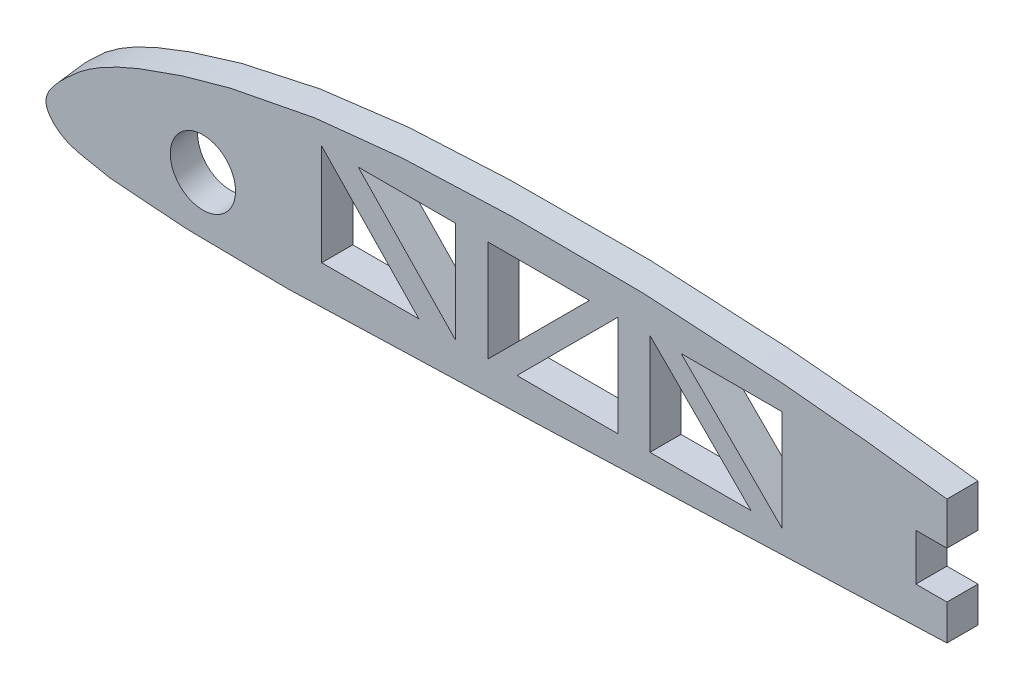
from build123d import *

# Parameters (mm, degrees)
SKETCH_4_W          = 2
SKETCH_4_H          = 3
CUT_EXTRUDE_1_DEPTH = 10
CUT_EXTRUDE_2_DEPTH = 10
SKETCH_7_R          = 2.1


with BuildPart() as part:
    # 边界1: read off the stored shape, not the designer's step
    # 边界1: loft between two sections, ruled curve by curve
    other_1_from = [
        Edge.make_bspline([(114.495486172, -0.065052731, 2), (112.525313713, -0.137418444, 2), (108.584936836, -0.282111358, 2), (102.674405126, -0.499184959, 2), (96.763856033, -0.716241585, 2), (91.838407723, -0.897137932, 2), (87.898044291, -1.041841681, 2), (84.942774489, -1.150391705, 2), (81.987503864, -1.258953778, 2), (79.032232565, -1.367478794, 2), (76.076958398, -1.475934997, 2), (73.12168408, -1.584382248, 2), (70.166411608, -1.692882482, 2), (67.211149141, -1.801653391, 2), (64.255892421, -1.910581232, 2), (61.300625434, -2.019229556, 2), (58.34532908, -2.127078553, 2), (55.390002445, -2.234089948, 2), (52.434708583, -2.342012705, 2), (49.479510926, -2.452535052, 2), (47.016955341, -2.54753161, 2), (45.046742895, -2.61905413, 2), (43.568961311, -2.669232614, 2), (42.091016655, -2.714387138, 2), (40.612889377, -2.75319201, 2), (39.134576881, -2.78416397, 2), (37.656086873, -2.805479396, 2), (36.177474753, -2.814931034, 2), (34.698825311, -2.810979174, 2), (33.220314429, -2.790618553, 2), (31.742108954, -2.753888604, 2), (30.264623613, -2.694123219, 2), (28.787927275, -2.619650713, 2), (27.558191615, -2.538256192, 2), (26.578186263, -2.430380652, 2), (25.846197236, -2.325486947, 2), (25.119410219, -2.189587549, 2), (24.393906066, -2.047208187, 2), (23.673072927, -1.88141167, 2), (23.098969383, -1.646698725, 2), (22.687774255, -1.372750645, 2), (22.405762629, -1.13272555, 2), (22.160415027, -0.854688888, 2), (21.968873367, -0.536042331, 2), (21.877041524, -0.171236682, 2), (21.932491412, 0.200662906, 2), (22.086819787, 0.53837321, 2), (22.291289979, 0.847230631, 2), (22.526145537, 1.133081398, 2), (22.777985786, 1.403785888, 2), (23.038654306, 1.665931032, 2), (23.302532619, 1.924798902, 2), (23.572222182, 2.177686933, 2), (23.94300328, 2.50252791, 2), (24.429622918, 2.881176313, 2), (25.045401109, 3.29111665, 2), (25.685591405, 3.661473232, 2), (26.342208206, 4.001575669, 2), (27.012317437, 4.31424432, 2), (27.692408294, 4.604359062, 2), (28.380035544, 4.876116393, 2), (29.073641491, 5.13213624, 2), (29.771562102, 5.376132386, 2), (30.473324083, 5.608835284, 2), (31.414127441, 5.903257348, 2), (32.599242862, 6.241189551, 2), (34.032937147, 6.603560906, 2), (35.475682008, 6.927865338, 2), (36.925796313, 7.217413086, 2), (38.38243318, 7.472115541, 2), (39.844922498, 7.690837739, 2), (41.801789711, 7.932030291, 2), (44.257157627, 8.148841893, 2), (47.210373206, 8.30816349, 2), (50.166102221, 8.406084649, 2), (53.122769422, 8.468100744, 2), (56.080133917, 8.481383364, 2), (59.037246841, 8.439956258, 2), (61.992862746, 8.336456991, 2), (64.946022813, 8.178834662, 2), (67.896174091, 7.972505736, 2), (70.843049381, 7.724040716, 2), (73.786093207, 7.433576909, 2), (76.724757768, 7.10180194, 2), (79.658466436, 6.728700193, 2), (82.587158849, 6.318307304, 2), (86.485672655, 5.72705015, 2), (91.347726065, 4.917789912, 2), (97.164206175, 3.843747138, 2), (102.960665954, 2.66719024, 2), (108.739776346, 1.407708383, 2), (112.577151384, 0.500675708, 2), (114.529394671, 0.037886323, 2), (114.596821986, 0.021902329, 2), (114.698157799, -0.002119851, 2), (114.799493613, -0.026142031, 2), (114.867050822, -0.042156817, 2), (114.900829426, -0.05016421, 2)], [0, 0, 0, 0, 0.031181105, 0.062362211, 0.093543316, 0.124724421, 0.140314974, 0.155905527, 0.171496079, 0.187086632, 0.202677185, 0.218267737, 0.23385829, 0.249448843, 0.265039395, 0.280629948, 0.296220501, 0.311811053, 0.327401606, 0.342992159, 0.358582711, 0.366377988, 0.374173264, 0.38196854, 0.389763817, 0.397559093, 0.405354369, 0.413149646, 0.420944922, 0.428740198, 0.436535474, 0.444330751, 0.452126027, 0.459921303, 0.463818942, 0.46771658, 0.471614218, 0.475511856, 0.479409494, 0.483307132, 0.485255952, 0.487204771, 0.48915359, 0.491102409, 0.493051228, 0.495000047, 0.496948866, 0.498897685, 0.500846504, 0.502795323, 0.504744142, 0.506692961, 0.508641781, 0.5105906, 0.514488238, 0.518385876, 0.522283514, 0.526181152, 0.53007879, 0.533976429, 0.537874067, 0.541771705, 0.545669343, 0.549566981, 0.553464619, 0.561259896, 0.569055172, 0.576850448, 0.584645725, 0.592441001, 0.600236277, 0.608031554, 0.623622106, 0.639212659, 0.654803212, 0.670393764, 0.685984317, 0.70157487, 0.717165422, 0.732755975, 0.748346528, 0.76393708, 0.779527633, 0.795118186, 0.810708738, 0.826299291, 0.841889844, 0.873070949, 0.904252054, 0.93543316, 0.966614265, 0.99779537, 0.99779537, 0.998346528, 0.998897685, 0.999448843, 1, 1, 1, 1], 3),
        Edge.make_line((114.900829426, -0.05016421, 2), (114.495486172, -0.065052731, 2)),
    ]
    other_1_to = [
        Edge.make_bspline([(114.494436874, -0.065091272, 0), (112.519164295, -0.137644316, 0), (108.568587489, -0.282712562, 0), (102.642754133, -0.50034686, 0), (96.716906123, -0.71796651, 0), (91.778706458, -0.899329433, 0), (87.828143038, -1.044409526, 0), (84.86522286, -1.153238964, 0), (81.902302125, -1.262083692, 0), (78.939380469, -1.370887028, 0), (75.976456211, -1.47962753, 0), (73.013531496, -1.588351231, 0), (70.050609157, -1.69714222, 0), (67.087696383, -1.806191874, 0), (64.124789301, -1.915397023, 0), (61.161872293, -2.024331861, 0), (58.19892541, -2.13245354, 0), (55.235948399, -2.239741975, 0), (52.273004055, -2.347939128, 0), (49.310156786, -2.458758462, 0), (46.841226159, -2.553993398, 0), (44.865913717, -2.625707031, 0), (43.384306508, -2.676011557, 0), (41.902535976, -2.721284207, 0), (40.420582303, -2.760189141, 0), (38.938442945, -2.791241446, 0), (37.456125609, -2.812611964, 0), (35.973685849, -2.822088107, 0), (34.491208669, -2.818125989, 0), (33.008870408, -2.797712668, 0), (31.526838344, -2.760887625, 0), (30.04552828, -2.700967523, 0), (28.56500926, -2.626302228, 0), (27.332090218, -2.544696989, 0), (26.349547957, -2.436542173, 0), (25.615664052, -2.331376914, 0), (24.886995626, -2.195125699, 0), (24.159613381, -2.052377767, 0), (23.436914251, -1.886152009, 0), (22.861324577, -1.650831376, 0), (22.449065053, -1.376174054, 0), (22.166323431, -1.135527566, 0), (21.920340771, -0.856771098, 0), (21.728303371, -0.537299607, 0), (21.636234005, -0.171549539, 0), (21.691827635, 0.201312739, 0), (21.846555611, 0.539897214, 0), (22.05155517, 0.849554126, 0), (22.287018723, 1.13614484, 0), (22.539510924, 1.407550076, 0), (22.800854235, 1.670373822, 0), (23.06541565, 1.929911809, 0), (23.335803361, 2.183454473, 0), (23.707544308, 2.509136334, 0), (24.195423667, 2.888764906, 0), (24.812795928, 3.299766409, 0), (25.454643482, 3.671081698, 0), (26.112960059, 4.012064526, 0), (26.784803992, 4.325542553, 0), (27.466655388, 4.616408291, 0), (28.156062684, 4.888869099, 0), (28.851464154, 5.145551684, 0), (29.551191455, 5.390179452, 0), (30.254770071, 5.623484724, 0), (31.198008864, 5.918668951, 0), (32.386192165, 6.257475904, 0), (33.823597816, 6.620785355, 0), (35.270077476, 6.945929198, 0), (36.723945649, 7.236226641, 0), (38.184353284, 7.491588117, 0), (39.65062849, 7.710877041, 0), (41.612561431, 7.952692849, 0), (44.074285409, 8.170067958, 0), (47.035146038, 8.329797938, 0), (49.998526223, 8.427979423, 0), (52.962847706, 8.490143425, 0), (55.927867077, 8.503483651, 0), (58.892635086, 8.4619306, 0), (61.855901957, 8.358166543, 0), (64.816706792, 8.200137578, 0), (67.774494984, 7.993272942, 0), (70.728998926, 7.744166511, 0), (73.679661001, 7.452948193, 0), (76.625933381, 7.120318459, 0), (79.567235887, 6.746247786, 0), (82.503510635, 6.334796721, 0), (86.41211395, 5.742010096, 0), (91.286755443, 4.930647196, 0), (97.118291571, 3.853828829, 0), (102.92975696, 2.674223702, 0), (108.72382731, 1.411482804, 0), (112.571136157, 0.502101649, 0), (114.52843315, 0.038114256, 0), (114.596035012, 0.022088885, 0), (114.69763315, -0.00199548, 0), (114.799231288, -0.026079845, 0), (114.86696338, -0.042136089, 0), (114.900829426, -0.05016421, 0)], [0, 0, 0, 0, 0.031181105, 0.062362211, 0.093543316, 0.124724421, 0.140314974, 0.155905527, 0.171496079, 0.187086632, 0.202677185, 0.218267737, 0.23385829, 0.249448843, 0.265039395, 0.280629948, 0.296220501, 0.311811053, 0.327401606, 0.342992159, 0.358582711, 0.366377988, 0.374173264, 0.38196854, 0.389763817, 0.397559093, 0.405354369, 0.413149646, 0.420944922, 0.428740198, 0.436535474, 0.444330751, 0.452126027, 0.459921303, 0.463818942, 0.46771658, 0.471614218, 0.475511856, 0.479409494, 0.483307132, 0.485255952, 0.487204771, 0.48915359, 0.491102409, 0.493051228, 0.495000047, 0.496948866, 0.498897685, 0.500846504, 0.502795323, 0.504744142, 0.506692961, 0.508641781, 0.5105906, 0.514488238, 0.518385876, 0.522283514, 0.526181152, 0.53007879, 0.533976429, 0.537874067, 0.541771705, 0.545669343, 0.549566981, 0.553464619, 0.561259896, 0.569055172, 0.576850448, 0.584645725, 0.592441001, 0.600236277, 0.608031554, 0.623622106, 0.639212659, 0.654803212, 0.670393764, 0.685984317, 0.70157487, 0.717165422, 0.732755975, 0.748346528, 0.76393708, 0.779527633, 0.795118186, 0.810708738, 0.826299291, 0.841889844, 0.873070949, 0.904252054, 0.93543316, 0.966614265, 0.99779537, 0.99779537, 0.998346528, 0.998897685, 0.999448843, 1, 1, 1, 1], 3),
        Edge.make_line((114.900829426, -0.05016421, 0), (114.494436874, -0.065091272, 0)),
    ]
    other_1 = Solid(Shell([*[Face.make_surface_from_curves(other_1_from[k], other_1_to[k]) for k in range(2)], Face(Wire(other_1_from)), Face(Wire(other_1_to))]))
    add(other_1)

    # 草图4 → 切除-拉伸1 (cut)
    with BuildSketch(Plane(origin=(0, 0, 0), x_dir=(-1, 0, 0), z_dir=(0, 0, -1))):
        with BuildLine():
            Line((-114.494436874, -0.065091272), (-114.900829426, -0.05016421))
            add(Edge.make_bspline(
                [(-79.900829426, 6.695076495), (-80.768768996, 6.577807683), (-82.614720329, 6.317930436), (-86.41211395, 5.742010096), (-91.286755443, 4.930647196), (-97.118291571, 3.853828829), (-102.92975696, 2.674223702), (-108.72382731, 1.411482804), (-112.571136157, 0.502101649), (-114.52843315, 0.038114256), (-114.596035012, 0.022088885), (-114.69763315, -0.00199548), (-114.799231288, -0.026079845), (-114.86696338, -0.042136089), (-114.900829426, -0.05016421)],
                knots=[0.812483102, 0.812483102, 0.812483102, 0.812483102, 0.826299291, 0.841889844, 0.873070949, 0.904252054, 0.93543316, 0.966614265, 0.99779537, 0.99779537, 0.998346528, 0.998897685, 0.999448843, 1, 1, 1, 1], degree=3))
            Line((-79.900829426, 6.695076495), (-79.900829426, 18.658578225))
            Line((-79.900829426, 18.658578225), (-129.726468116, 18.658578225))
            Line((-129.726468116, 18.658578225), (-129.726468116, -11.419460933))
            Line((-129.726468116, -11.419460933), (-79.900829426, -11.419460933))
            Line((-79.900829426, -11.419460933), (-79.900829426, -1.335577579))
            add(Edge.make_bspline(
                [(-114.494436874, -0.065091272), (-112.519164295, -0.137644316), (-108.568587489, -0.282712562), (-102.642754133, -0.50034686), (-96.716906123, -0.71796651), (-91.778706458, -0.899329433), (-87.828143038, -1.044409526), (-84.86522286, -1.153238964), (-82.222785057, -1.250310553), (-80.567987069, -1.311081199), (-79.900829426, -1.335577579)],
                knots=[0, 0, 0, 0, 0.031181105, 0.062362211, 0.093543316, 0.124724421, 0.140314974, 0.155905527, 0.171496079, 0.182027597, 0.182027597, 0.182027597, 0.182027597], degree=3))
        make_face()
        with BuildLine():
            add(Edge.make_bspline(
                [(-79.900829426, 6.695076495), (-80.768768996, 6.577807683), (-82.614720329, 6.317930436), (-86.41211395, 5.742010096), (-91.286755443, 4.930647196), (-97.118291571, 3.853828829), (-102.92975696, 2.674223702), (-108.72382731, 1.411482804), (-112.571136157, 0.502101649), (-114.52843315, 0.038114256), (-114.596035012, 0.022088885), (-114.69763315, -0.00199548), (-114.799231288, -0.026079845), (-114.86696338, -0.042136089), (-114.900829426, -0.05016421)],
                knots=[0.812483102, 0.812483102, 0.812483102, 0.812483102, 0.826299291, 0.841889844, 0.873070949, 0.904252054, 0.93543316, 0.966614265, 0.99779537, 0.99779537, 0.998346528, 0.998897685, 0.999448843, 1, 1, 1, 1], degree=3))
            Line((-114.900829426, -0.05016421), (-79.900829426, -0.05016421))
            Line((-79.900829426, -0.05016421), (-79.900829426, 0.94983579))
            Line((-79.900829426, 0.94983579), (-79.900829426, 3.94983579))
            Line((-79.900829426, 3.94983579), (-79.900829426, 6.695076495))
        make_face()
        with BuildLine():
            Line((-79.900829426, -0.05016421), (-114.900829426, -0.05016421))
            Line((-114.900829426, -0.05016421), (-114.494436874, -0.065091272))
            add(Edge.make_bspline(
                [(-114.494436874, -0.065091272), (-112.519164295, -0.137644316), (-108.568587489, -0.282712562), (-102.642754133, -0.50034686), (-96.716906123, -0.71796651), (-91.778706458, -0.899329433), (-87.828143038, -1.044409526), (-84.86522286, -1.153238964), (-82.222785057, -1.250310553), (-80.567987069, -1.311081199), (-79.900829426, -1.335577579)],
                knots=[0, 0, 0, 0, 0.031181105, 0.062362211, 0.093543316, 0.124724421, 0.140314974, 0.155905527, 0.171496079, 0.182027597, 0.182027597, 0.182027597, 0.182027597], degree=3))
            Line((-79.900829426, -1.335577579), (-79.900829426, -0.05016421))
        make_face()
        with Locations((-78.900829426, 2.44983579)):
            Rectangle(SKETCH_4_W, SKETCH_4_H)
    extrude(amount=-CUT_EXTRUDE_1_DEPTH, mode=Mode.SUBTRACT)

    # 草图5 → 切除-拉伸2 (cut)
    with BuildSketch(Plane(origin=(0, 0, 0), x_dir=(-1, 0, 0), z_dir=(0, 0, -1))):
        Polygon((-39.648744805, 6.249620473), (-39.648744805, -0.261312129), (-45.909256923, -0.261312129), align=None)
        Polygon((-42.002697362, 6.249620473), (-48.26320948, -0.261312129), (-48.26320948, 6.249620473), align=None)
        Polygon((-50.366741551, 6.249620473), (-50.366741551, -0.261312129), (-56.877674154, 6.249620473), align=None)
        Polygon((-58.730785741, 6.249620473), (-52.219853138, -0.261312129), (-58.730785741, -0.261312129), align=None)
        Polygon((-60.784233716, 6.249620473), (-60.784233716, -0.261312129), (-67.295166318, -0.261312129), align=None)
        Polygon((-62.787597593, 6.249620473), (-69.298530196, -0.261312129), (-69.298530196, 6.249620473), align=None)
    extrude(amount=-CUT_EXTRUDE_2_DEPTH, mode=Mode.SUBTRACT)

    # 切除-扫描1: sweep along a path in 草图8
    with BuildLine(Plane(origin=(114.900829426, -0.05016421, -180), x_dir=(1, 0, 0), z_dir=(0, 1, 0))) as sweep_1_path:
        Line((-200, 0), (-160.4, -329))
    # 草图7 → 切除-扫描1 (sweep, cut)
    with BuildSketch(Plane(origin=(114.900829426, -0.05016421, -180), x_dir=(-1, 0, 0), z_dir=(0, 0, -1))):
        with Locations((104.805246224, 1)):
            Circle(SKETCH_7_R)
    sweep(path=sweep_1_path.line, mode=Mode.SUBTRACT)


solid = part.part
